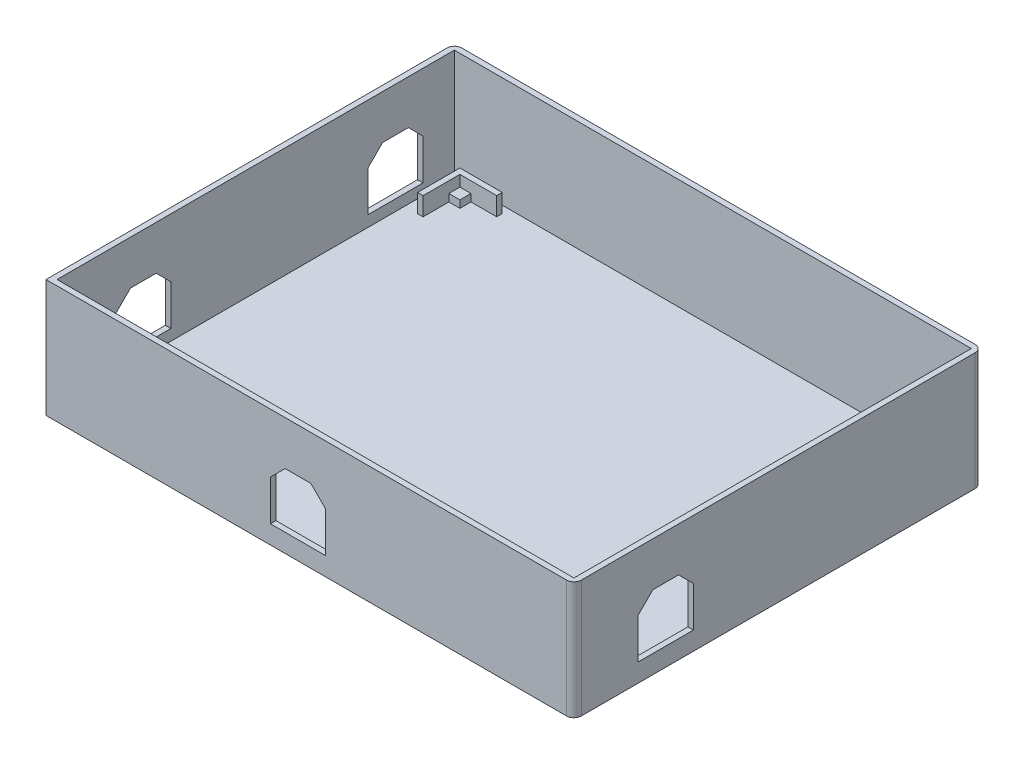
from build123d import *

# Parameters (mm, degrees)
SKETCH1_W                = 1600
SKETCH1_H                = 1600
BOSS_EXTRUDE1_DEPTH      = 2
SKETCH2_R                = 1.585
BOSS_EXTRUDE2_DEPTH      = 5
SKETCH3_W                = 1.5
SKETCH3_H                = 10.8
SKETCH3_H_2              = 16.825
BOSS_EXTRUDE3_DEPTH      = 30
CUT_EXTRUDE1_DEPTH       = 1132.768527571
CUT_EXTRUDE1_DEPTH_BACK  = 1132.768527571
SKETCH5_OUTSIDE_W        = 2054.594
SKETCH5_OUTSIDE_H        = 2054.594
SKETCH5_OUTSIDE_W_2      = 200
SKETCH5_OUTSIDE_H_2      = 200
SKETCH6_W                = 200
SKETCH6_H                = 97
BOSS_EXTRUDE4_DEPTH      = 2
BOSS_EXTRUDE6_DEPTH      = 30
CUT_EXTRUDE7_START       = -2
CUT_EXTRUDE7_DEPTH       = 32
SKETCH15_W               = 48.54
SKETCH15_H               = 10.95
BOSS_EXTRUDE8_DEPTH      = 1.5
CHAMFER1_SIZE            = 3
CUT_EXTRUDE9_DEPTH       = 1132.768527571
CUT_EXTRUDE9_DEPTH_BACK  = 1132.768527571
SKETCH16_W               = 83.170959918
SKETCH16_H               = 74.318470717
BOSS_EXTRUDE9_DEPTH      = 30
CUT_EXTRUDE8_DEPTH       = 814.397965328
CUT_EXTRUDE8_DEPTH_BACK  = 814.397965328
SKETCH18_W               = 20.53541424
SKETCH18_H               = 18.617271152
BOSS_EXTRUDE10_DEPTH     = 1.5
BOSS_EXTRUDE11_DEPTH     = 5
SKETCH20_W               = 3
SKETCH20_H               = 3
BOSS_EXTRUDE12_DEPTH     = 2
FILLET1_R                = 2
BOSS_EXTRUDE13_DEPTH     = 30
CUT_EXTRUDE10_DEPTH      = 1132.823307765
CUT_EXTRUDE10_DEPTH_BACK = 1132.823307765
SKETCH22_W               = 118.842145749
SKETCH22_H               = 72.51699158
CUT_EXTRUDE11_DEPTH      = 20


# Read off the part's stored shape, not the designer's step: Cut-Extrude7
with BuildPart() as part:
    # Sketch1 → Boss-Extrude1 (new body)
    with BuildSketch(Plane(origin=(0, 0, 0), x_dir=(1, 0, 0), z_dir=(0, 1, 0))):
        Rectangle(SKETCH1_W, SKETCH1_H)
    extrude(amount=BOSS_EXTRUDE1_DEPTH)

    # Sketch2 → Boss-Extrude2 (add)
    with BuildSketch(Plane(origin=(0, 2, 0), x_dir=(1, 0, 0), z_dir=(0, 1, 0))):
        with Locations(Location((-782.85, -746.2, 0), (0, 0, 270))):
            Circle(SKETCH2_R)
        with Locations(Location((-732.05, -761.44, 0), (0, 0, 270))):
            Circle(SKETCH2_R)
        with Locations(Location((-784.12, -794.46, 0), (0, 0, 270))):
            Circle(SKETCH2_R)
        with Locations(Location((-732.05, -789.38, 0), (0, 0, 270))):
            Circle(SKETCH2_R)
    extrude(amount=BOSS_EXTRUDE2_DEPTH)

    # Sketch3 → Boss-Extrude3 (add)
    with BuildSketch(Plane(origin=(0, 2, 0), x_dir=(1, 0, 0), z_dir=(0, 1, 0))):
        with Locations((-799.25, -746.06)):
            Rectangle(SKETCH3_W, SKETCH3_H)
        Polygon((-798.5, -800), (-800, -800), (-800, -795.325), (-798.5, -795.325), (-798.5, -798.5), (-648.5, -798.5), (-648.5, -800), align=None)
        with Locations((-799.25, -774.9125)):
            Rectangle(SKETCH3_W, SKETCH3_H_2)
    extrude(amount=BOSS_EXTRUDE3_DEPTH)

    # Sketch5 outside → Cut-Extrude1 (cut, two sides: drawn at the far end of the back side and taken through both)
    with BuildSketch(Plane(origin=(0, 2, 0), x_dir=(1, 0, 0), z_dir=(0, 1, 0)).offset(-CUT_EXTRUDE1_DEPTH_BACK)):
        Rectangle(SKETCH5_OUTSIDE_W, SKETCH5_OUTSIDE_H)
        with Locations((-700, -700)):
            Rectangle(SKETCH5_OUTSIDE_W_2, SKETCH5_OUTSIDE_H_2, mode=Mode.SUBTRACT)
    extrude(amount=CUT_EXTRUDE1_DEPTH + CUT_EXTRUDE1_DEPTH_BACK, mode=Mode.SUBTRACT)

    # Sketch6 → Boss-Extrude4 (add)
    with BuildSketch(Plane(origin=(0, 2, 0), x_dir=(1, 0, 0), z_dir=(0, 1, 0))):
        with Locations((-698.5, -652.5)):
            Rectangle(SKETCH6_W, SKETCH6_H)
    extrude(amount=-BOSS_EXTRUDE4_DEPTH)

    # Sketch7 → Boss-Extrude6 (add)
    with BuildSketch(Plane(origin=(0, 2, 0), x_dir=(1, 0, 0), z_dir=(0, 1, 0))):
        Polygon((-798.5, -740.66), (-798.5, -601.5), (-601.5, -601.5), (-601.5, -605.5), (-600, -605.5), (-600, -699.5), (-601.5, -699.5), (-601.5, -798.5), (-648.5, -798.5), (-648.5, -800), (-600, -800), (-600, -701), (-598.5, -701), (-598.5, -604), (-600, -604), (-600, -600), (-800, -600), (-800, -740.66), align=None)
    extrude(amount=BOSS_EXTRUDE6_DEPTH)

    # Cut-Extrude7 outline → Cut-Extrude7 (cut)
    with BuildSketch(Plane(origin=(0, 2, 0), x_dir=(1, 0, 0), z_dir=(0, 1, 0)).offset(CUT_EXTRUDE7_START)):
        Polygon((-656.5, -632.91), (-656.5, -800), (-600, -800), (-600, -701), (-598.5, -701), (-598.5, -604), (-600, -604), (-600, -600), (-800, -600), (-800, -632.91), align=None)
    extrude(amount=CUT_EXTRUDE7_DEPTH, mode=Mode.SUBTRACT)

    # Sketch15 → Boss-Extrude8 (add)
    with BuildSketch(Plane.ZY.offset(800)):
        with Locations((775.73, 26.525)):
            Rectangle(SKETCH15_W, SKETCH15_H)
    extrude(amount=-BOSS_EXTRUDE8_DEPTH)

    # Chamfer1
    chamfer1_edges = [part.edges().sort_by_distance(p)[0] for p in [
        (-799.25, 21.05, 766.5),
        (-799.25, 21.05, 795.325),
        (-799.25, 21.05, 751.46),
        (-799.25, 21.05, 783.325),
    ]]
    chamfer(chamfer1_edges, length=CHAMFER1_SIZE)

    # Sketch16 → Cut-Extrude9 (cut, two sides: drawn at the far end of the back side and taken through both)
    with BuildSketch(Plane(origin=(0, 2, 0), x_dir=(1, 0, 0), z_dir=(0, 1, 0)).offset(-CUT_EXTRUDE9_DEPTH_BACK)):
        with Locations((-682.924520041, -781.069235359)):
            Rectangle(SKETCH16_W, SKETCH16_H)
    extrude(amount=CUT_EXTRUDE9_DEPTH + CUT_EXTRUDE9_DEPTH_BACK, mode=Mode.SUBTRACT)

    # Sketch17 → Boss-Extrude9 (add)
    with BuildSketch(Plane(origin=(0, 2, 0), x_dir=(1, 0, 0), z_dir=(0, 1, 0))):
        Polygon((-798.5, -632.91), (-656.5, -632.91), (-656.5, -743.91), (-724.51, -743.91), (-724.51, -800), (-726.01, -800), (-726.01, -742.41), (-658, -742.41), (-658, -634.41), (-798.5, -634.41), align=None)
    extrude(amount=BOSS_EXTRUDE9_DEPTH)

    # Sketch14 → Cut-Extrude8 (cut, two sides: drawn at the far end of the back side and taken through both)
    with BuildSketch(Plane.ZY.offset(800).offset(-CUT_EXTRUDE8_DEPTH_BACK)):
        Polygon((642.91, 5), (657.91, 5), (657.91, 16), (653.91, 20), (646.91, 20), (642.91, 16), align=None)
        Polygon((711.46, 5), (726.46, 5), (726.46, 16), (722.46, 20), (715.46, 20), (711.46, 16), align=None)
    extrude(amount=CUT_EXTRUDE8_DEPTH + CUT_EXTRUDE8_DEPTH_BACK, mode=Mode.SUBTRACT)

    # Sketch18 → Boss-Extrude10 (add)
    with BuildSketch(Plane(origin=(-656.5, 0, 0), x_dir=(0, 0, -1), z_dir=(1, 0, 0))):
        with Locations((-651.07097558, 11.926550953)):
            Rectangle(SKETCH18_W, SKETCH18_H)
    extrude(amount=-BOSS_EXTRUDE10_DEPTH)

    # Sketch19 → Boss-Extrude11 (add)
    with BuildSketch(Plane(origin=(0, 2, 0), x_dir=(1, 0, 0), z_dir=(0, 1, 0))):
        Polygon((-793.5, -647.91), (-795, -647.91), (-795, -636.41), (-783.5, -636.41), (-783.5, -637.91), (-793.5, -637.91), align=None)
        Polygon((-661.5, -647.91), (-660, -647.91), (-660, -636.41), (-671.5, -636.41), (-671.5, -637.91), (-661.5, -637.91), align=None)
        Polygon((-661.5, -728.91), (-658, -728.91), (-658, -742.41), (-671.5, -742.41), (-671.5, -738.91), (-661.5, -738.91), align=None)
        Polygon((-793.5, -728.91), (-795, -728.91), (-795, -740.41), (-783.5, -740.41), (-783.5, -738.91), (-793.5, -738.91), align=None)
    extrude(amount=BOSS_EXTRUDE11_DEPTH)

    # Sketch20 → Boss-Extrude12 (add)
    with BuildSketch(Plane(origin=(0, 2, 0), x_dir=(1, 0, 0), z_dir=(0, 1, 0))):
        with Locations((-792, -639.41)):
            Rectangle(SKETCH20_W, SKETCH20_H)
        with Locations((-663, -639.41)):
            Rectangle(SKETCH20_W, SKETCH20_H)
        with Locations((-663, -737.41)):
            Rectangle(SKETCH20_W, SKETCH20_H)
        with Locations((-792, -737.41)):
            Rectangle(SKETCH20_W, SKETCH20_H)
    extrude(amount=BOSS_EXTRUDE12_DEPTH)

    # Fillet1
    fillet1_edges = [part.edges().sort_by_distance(p)[0] for p in [
        (-656.5, 16, 632.91),
        (-800, 16, 632.91),
        (-656.5, 16, 743.91),
        (-724.51, 16, 800),
        (-724.51, 16, 743.91),
        (-800, 16, 800),
    ]]
    fillet(fillet1_edges, radius=FILLET1_R)

    # Sketch21 → Boss-Extrude13 (add)
    with BuildSketch(Plane(origin=(0, 2, 0), x_dir=(1, 0, 0), z_dir=(0, 1, 0))):
        Polygon((-726.01, -742.41), (-798.5, -742.41), (-800, -743.91), (-720.182968703, -743.91), align=None)
    extrude(amount=BOSS_EXTRUDE13_DEPTH)

    # Sketch22 → Cut-Extrude10 (cut, two sides: drawn at the far end of the back side and taken through both)
    with BuildSketch(Plane(origin=(0, 32, 0), x_dir=(1, 0, 0), z_dir=(0, 1, 0)).offset(-CUT_EXTRUDE10_DEPTH_BACK)):
        with Locations((-761.569685202, -780.16849579)):
            Rectangle(SKETCH22_W, SKETCH22_H)
    extrude(amount=CUT_EXTRUDE10_DEPTH + CUT_EXTRUDE10_DEPTH_BACK, mode=Mode.SUBTRACT)

    # Sketch23 → Cut-Extrude11 (cut)
    with BuildSketch(Plane.XY.offset(743.91)):
        Polygon((-735, 20), (-728, 20), (-724, 16), (-724, 5), (-739, 5), (-739, 16), align=None)
    extrude(amount=-CUT_EXTRUDE11_DEPTH, mode=Mode.SUBTRACT)


solid = part.part
